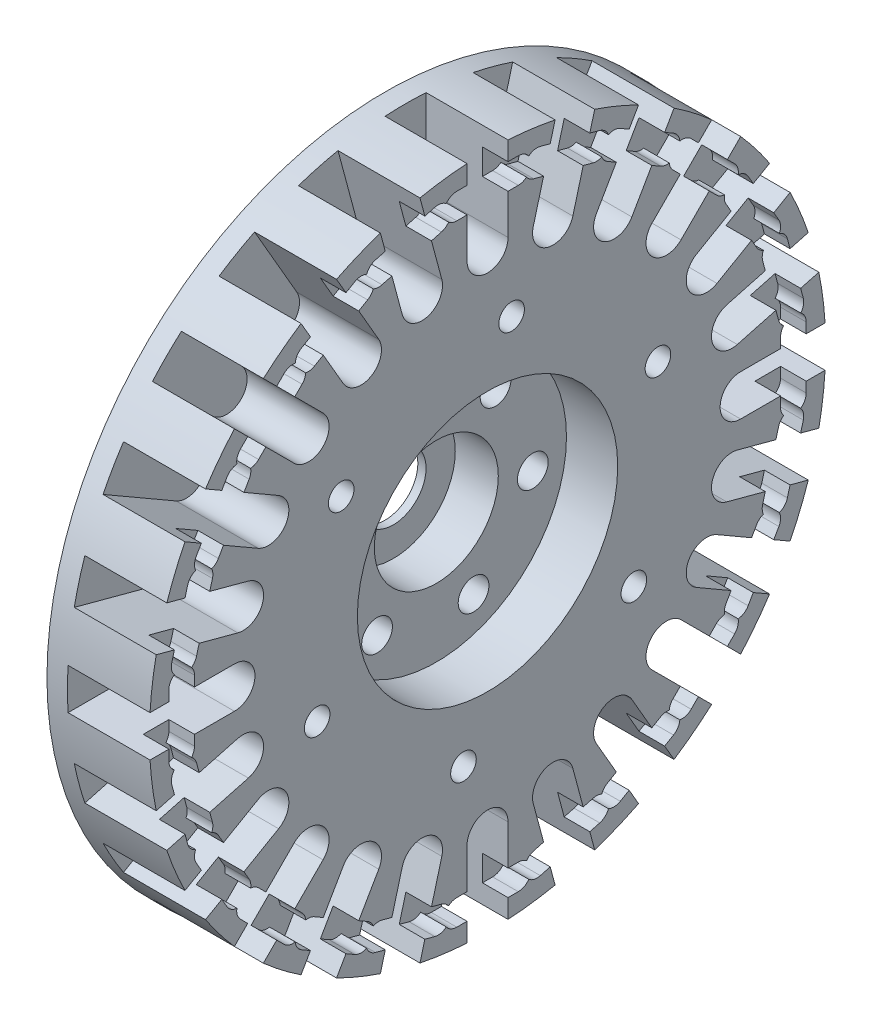
from build123d import *

# Parameters (mm, degrees)
SKETCH1_R                    = 33
SKETCH1_R_2                  = 3.2
BOSS_EXTRUDE1_DEPTH          = 10
CUT_EXTRUDE1_DEPTH           = 8
CUT_EXTRUDE2_DEPTH           = 2.5
CIRPATTERN1_COUNT            = 24
CIRPATTERN2_COUNT            = 6
SKETCH7_R                    = 12.705
CUT_EXTRUDE3_DEPTH           = 5
SKETCH12_R                   = 6.05
CUT_EXTRUDE5_DEPTH           = 4.2
CUT_EXTRUDE4_REACH           = 49.728
SKETCH11_R                   = 1.5
CHAMFER1_SIZE                = 1.5
CIRPATTERN3_COUNT            = 6
CHAMFER1_OF_CIRPATTERN3_SIZE = 1.5


with BuildPart() as part:
    # Sketch1 → Boss-Extrude1 (new body)
    with BuildSketch(Plane(origin=(0, 0, 0), x_dir=(0, 0, -1), z_dir=(1, 0, 0))):
        Circle(SKETCH1_R)
        Circle(SKETCH1_R_2, mode=Mode.SUBTRACT)
    extrude(amount=BOSS_EXTRUDE1_DEPTH)

    # Sketch2 → Cut-Extrude1 (cut)
    with BuildSketch(Plane(origin=(10, 0, 0), x_dir=(0, 0, -1), z_dir=(1, 0, 0))):
        with BuildLine():
            Line((-2, 33), (2, 33))
            Line((2, 33), (2, 24.7))
            ThreePointArc((2, 24.7), (0, 22.7), (-2, 24.7))
            Line((-2, 24.7), (-2, 33))
        make_face()
    cut_extrude1 = extrude(amount=-CUT_EXTRUDE1_DEPTH, mode=Mode.SUBTRACT)

    # Sketch3 → Cut-Extrude2 (cut)
    with BuildSketch(Plane(origin=(10, 0, 0), x_dir=(0, 0, -1), z_dir=(1, 0, 0))):
        with BuildLine():
            Line((-3, 31.1), (3, 31.1))
            ThreePointArc((3, 31.1), (4.25, 29.85), (3, 28.6))
            Line((3, 28.6), (-3, 28.6))
            ThreePointArc((-3, 28.6), (-4.25, 29.85), (-3, 31.1))
        make_face()
    cut_extrude2 = extrude(amount=-CUT_EXTRUDE2_DEPTH, mode=Mode.SUBTRACT)

    # CirPattern1: Cut-Extrude1, Cut-Extrude2 ×24 about axis
    cirpattern1_axis = Axis((10, 0, 0), (1, 0, 0))
    add([cut_extrude1.rotate(cirpattern1_axis, i * 360 / CIRPATTERN1_COUNT) for i in range(1, CIRPATTERN1_COUNT)], mode=Mode.SUBTRACT)
    add([cut_extrude2.rotate(cirpattern1_axis, i * 360 / CIRPATTERN1_COUNT) for i in range(1, CIRPATTERN1_COUNT)], mode=Mode.SUBTRACT)

    # Sketch5 → Tap Drill for M3x0.5 Tap1 (revolve, cut)
    with BuildSketch(Plane(origin=(10, 17.846007505, -2.34947146), x_dir=(0, 0, -1), z_dir=(0, 1, 0))):
        Polygon((0, 0), (0, 8.751075774), (1.25, 8), (1.25, 0), align=None)
    tap_drill_for_m3x0_5_tap1 = revolve(axis=Axis((16.35, 17.846007505, -2.34947146), (-1, 0, 0)), mode=Mode.SUBTRACT)

    # CirPattern2: Tap Drill for M3x0.5 Tap1 ×6 about axis
    cirpattern2_axis = Axis((10, 0, 0), (1, 0, 0))
    for i in range(1, CIRPATTERN2_COUNT):
        add(tap_drill_for_m3x0_5_tap1.rotate(cirpattern2_axis, i * 360 / CIRPATTERN2_COUNT), mode=Mode.SUBTRACT)

    # Sketch7 → Cut-Extrude3 (cut)
    with BuildSketch(Plane.ZY.offset(-10)):
        Circle(SKETCH7_R)
    extrude(amount=CUT_EXTRUDE3_DEPTH, mode=Mode.SUBTRACT)

    # Sketch12 → Cut-Extrude5 (cut)
    with BuildSketch(Plane(origin=(5, 0, 0), x_dir=(0, 0, -1), z_dir=(1, 0, 0))):
        Circle(SKETCH12_R)
    extrude(amount=-CUT_EXTRUDE5_DEPTH, mode=Mode.SUBTRACT)

    # Sketch11 → Cut-Extrude4 (cut, up to next)
    with BuildSketch(Plane(origin=(10, 0, 0), x_dir=(0, 0, -1), z_dir=(1, 0, 0)), mode=Mode.PRIVATE) as cut_extrude4_sk1:
        with Locations((-3.635492607, 8.776855559)):
            Circle(SKETCH11_R)
    cut_extrude4_tool1 = extrude(cut_extrude4_sk1.sketch, amount=-CUT_EXTRUDE4_REACH, mode=Mode.PRIVATE) & part.part
    cut_extrude4 = cut_extrude4_tool1.solids().sort_by_distance((10, 8.776856, 3.635493))[0]
    add(cut_extrude4, mode=Mode.SUBTRACT)

    # Chamfer1
    chamfer1_edges = [part.edges().sort_by_distance(p)[0] for p in [
        (0, 8.776855559, 5.135492607),
    ]]
    chamfer(chamfer1_edges, length=CHAMFER1_SIZE)

    # CirPattern3: Cut-Extrude4 ×6 about axis
    cirpattern3_axis = Axis((0, 0, 0), (1, 0, 0))
    for i in range(1, CIRPATTERN3_COUNT):
        add(cut_extrude4.rotate(cirpattern3_axis, i * 360 / CIRPATTERN3_COUNT), mode=Mode.SUBTRACT)

    # Chamfer1 of CirPattern3
    chamfer1_of_cirpattern3_edges = [part.edges().sort_by_distance(p)[0] for p in [
        (0, -0.05903928, 10.168726183),
        (0, -8.835894838, 5.033233576),
        (0, -8.776855559, -5.135492607),
        (0, 0.05903928, -10.168726183),
        (0, 8.835894838, -5.033233576),
    ]]
    chamfer(chamfer1_of_cirpattern3_edges, length=CHAMFER1_OF_CIRPATTERN3_SIZE)


solid = part.part
